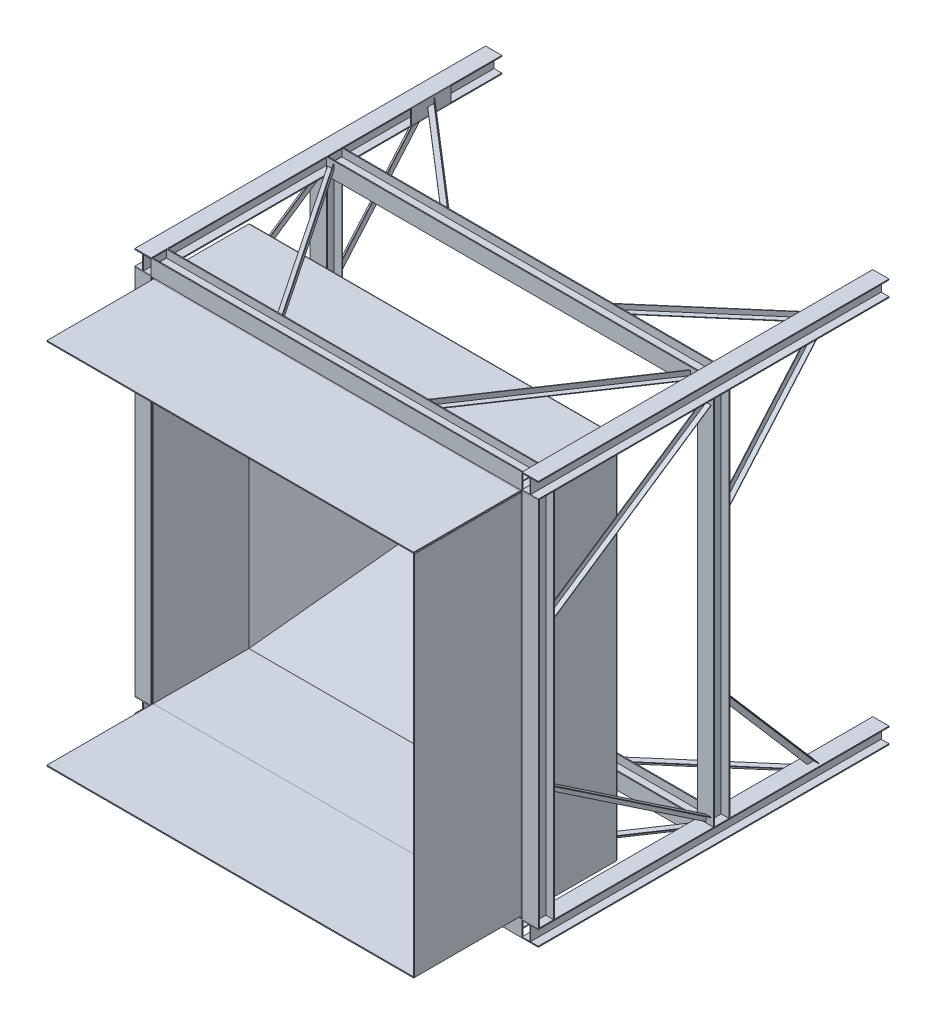
from build123d import *

# Parameters (mm, degrees)
COLUMNA_H_1_DEPTH                            = 3300
COLUMNA_H_2_DEPTH                            = 3300
COLUMNA_H_3_DEPTH                            = 3300
COLUMNA_H_4_DEPTH                            = 3300
VIGA_H_CARGA_1650_DEPTH                      = 3490
VIGA_H_CARGA_3300_DEPTH                      = 3490
CONTORNO_CIERRE_COLUMNA_CARGA_A_W            = 370
CONTORNO_CIERRE_COLUMNA_CARGA_A_H            = 135
CIERRE_COLUMNA_CARGA_A_DEPTH                 = 8
ALA_PLANA_ANGULAR_SUPERIOR_CARGA_A_DEPTH     = 5
RETORNO_ANGULAR_SUPERIOR_CARGA_A_DEPTH       = 45
ALA_PLANA_ANGULAR_INFERIOR_CARGA_A_DEPTH     = 5
RETORNO_ANGULAR_INFERIOR_CARGA_A_DEPTH       = 45
CONTORNO_CIERRE_COLUMNA_CARGA_B_W            = 370
CONTORNO_CIERRE_COLUMNA_CARGA_B_H            = 135
CIERRE_COLUMNA_CARGA_B_DEPTH                 = 8
ALA_PLANA_ANGULAR_SUPERIOR_CARGA_B_DEPTH     = 5
RETORNO_ANGULAR_SUPERIOR_CARGA_B_DEPTH       = 45
ALA_PLANA_ANGULAR_INFERIOR_CARGA_B_DEPTH     = 5
RETORNO_ANGULAR_INFERIOR_CARGA_B_DEPTH       = 45
CONTORNO_ASIENTO_SOLDADO_CARGA_W             = 2900
CONTORNO_ASIENTO_SOLDADO_CARGA_H             = 83.725
ASIENTO_SOLDADO_CARGA_DEPTH                  = 9.525
VIGA_H_FONDO_1650_DEPTH                      = 3490
VIGA_H_FONDO_3300_DEPTH                      = 3490
CONTORNO_CIERRE_COLUMNA_FONDO_A_W            = 370
CONTORNO_CIERRE_COLUMNA_FONDO_A_H            = 135
CIERRE_COLUMNA_FONDO_A_DEPTH                 = 8
ALA_PLANA_ANGULAR_SUPERIOR_FONDO_A_DEPTH     = 5
RETORNO_ANGULAR_SUPERIOR_FONDO_A_DEPTH       = 45
ALA_PLANA_ANGULAR_INFERIOR_FONDO_A_DEPTH     = 5
RETORNO_ANGULAR_INFERIOR_FONDO_A_DEPTH       = 45
CONTORNO_CIERRE_COLUMNA_FONDO_B_W            = 370
CONTORNO_CIERRE_COLUMNA_FONDO_B_H            = 135
CIERRE_COLUMNA_FONDO_B_DEPTH                 = 8
ALA_PLANA_ANGULAR_SUPERIOR_FONDO_B_DEPTH     = 5
RETORNO_ANGULAR_SUPERIOR_FONDO_B_DEPTH       = 45
ALA_PLANA_ANGULAR_INFERIOR_FONDO_B_DEPTH     = 5
RETORNO_ANGULAR_INFERIOR_FONDO_B_DEPTH       = 45
CONTORNO_ASIENTO_SOLDADO_FONDO_W             = 2900
CONTORNO_ASIENTO_SOLDADO_FONDO_H             = 83.725
ASIENTO_SOLDADO_FONDO_DEPTH                  = 9.525
VIGA_H_IZQUIERDA_1650_DEPTH                  = 3490
VIGA_H_IZQUIERDA_3300_DEPTH                  = 3490
ALA_PLANA_ANGULAR_SUPERIOR_IZQUIERDA_A_DEPTH = 5
RETORNO_ANGULAR_SUPERIOR_IZQUIERDA_A_DEPTH   = 45
ALA_PLANA_ANGULAR_INFERIOR_IZQUIERDA_A_DEPTH = 5
RETORNO_ANGULAR_INFERIOR_IZQUIERDA_A_DEPTH   = 45
ALA_PLANA_ANGULAR_SUPERIOR_IZQUIERDA_B_DEPTH = 5
RETORNO_ANGULAR_SUPERIOR_IZQUIERDA_B_DEPTH   = 45
ALA_PLANA_ANGULAR_INFERIOR_IZQUIERDA_B_DEPTH = 5
RETORNO_ANGULAR_INFERIOR_IZQUIERDA_B_DEPTH   = 45
CONTORNO_ASIENTO_SOLDADO_IZQUIERDA_W         = 83.725
CONTORNO_ASIENTO_SOLDADO_IZQUIERDA_H         = 2900
ASIENTO_SOLDADO_IZQUIERDA_DEPTH              = 9.525
VIGA_H_DERECHA_1650_DEPTH                    = 3490
VIGA_H_DERECHA_3300_DEPTH                    = 3490
ALA_PLANA_ANGULAR_SUPERIOR_DERECHA_A_DEPTH   = 5
RETORNO_ANGULAR_SUPERIOR_DERECHA_A_DEPTH     = 45
ALA_PLANA_ANGULAR_INFERIOR_DERECHA_A_DEPTH   = 5
RETORNO_ANGULAR_INFERIOR_DERECHA_A_DEPTH     = 45
ALA_PLANA_ANGULAR_SUPERIOR_DERECHA_B_DEPTH   = 5
RETORNO_ANGULAR_SUPERIOR_DERECHA_B_DEPTH     = 45
ALA_PLANA_ANGULAR_INFERIOR_DERECHA_B_DEPTH   = 5
RETORNO_ANGULAR_INFERIOR_DERECHA_B_DEPTH     = 45
CONTORNO_ASIENTO_SOLDADO_DERECHA_W           = 83.725
CONTORNO_ASIENTO_SOLDADO_DERECHA_H           = 2900
ASIENTO_SOLDADO_DERECHA_DEPTH                = 9.525
CONTORNO_COLLAR_LATERAL_Y_NEGATIVO_W         = 3450
CONTORNO_COLLAR_LATERAL_Y_NEGATIVO_H         = 900
COLLAR_LATERAL_Y_NEGATIVO_DEPTH              = 9.525
CONTORNO_ALER_N_LATERAL_Y_NEGATIVO_W         = 3450
CONTORNO_ALER_N_LATERAL_Y_NEGATIVO_H         = 1000
ALER_N_LATERAL_Y_NEGATIVO_DEPTH              = 9.525
EMBUDO_LATERAL_Y_NEGATIVO_DEPTH              = 9.525
CONTORNO_COLLAR_DERECHA_W                    = 900
CONTORNO_COLLAR_DERECHA_H                    = 3450
COLLAR_DERECHA_DEPTH                         = 9.525
CONTORNO_ALER_N_DERECHA_W                    = 1000
CONTORNO_ALER_N_DERECHA_H                    = 3450
ALER_N_DERECHA_DEPTH                         = 9.525
EMBUDO_DERECHA_DEPTH                         = 9.525
CONTORNO_COLLAR_LATERAL_Y_POSITIVO_W         = 3450
CONTORNO_COLLAR_LATERAL_Y_POSITIVO_H         = 900
COLLAR_LATERAL_Y_POSITIVO_DEPTH              = 9.525
CONTORNO_ALER_N_LATERAL_Y_POSITIVO_W         = 3450
CONTORNO_ALER_N_LATERAL_Y_POSITIVO_H         = 1000
ALER_N_LATERAL_Y_POSITIVO_DEPTH              = 9.525
EMBUDO_LATERAL_Y_POSITIVO_DEPTH              = 9.525
CONTORNO_COLLAR_CARGA_W                      = 900
CONTORNO_COLLAR_CARGA_H                      = 3450
COLLAR_CARGA_DEPTH                           = 9.525
EMBUDO_CARGA_DEPTH                           = 9.525


with BuildPart() as part:
    # Contorno Columna H 1 → Columna H 1 (new body)
    with BuildSketch(Plane.XY):
        Polygon((-1898, -1898), (-1745, -1898), (-1745, -1889), (-1818.25, -1889), (-1818.25, -1754), (-1745, -1754), (-1745, -1745), (-1898, -1745), (-1898, -1754), (-1824.75, -1754), (-1824.75, -1889), (-1898, -1889), align=None)
    extrude(amount=COLUMNA_H_1_DEPTH)


with BuildPart() as body_2:
    # Contorno Columna H 2 → Columna H 2 (new body)
    with BuildSketch(Plane.XY):
        Polygon((-1898, 1745), (-1745, 1745), (-1745, 1754), (-1818.25, 1754), (-1818.25, 1889), (-1745, 1889), (-1745, 1898), (-1898, 1898), (-1898, 1889), (-1824.75, 1889), (-1824.75, 1754), (-1898, 1754), align=None)
    extrude(amount=COLUMNA_H_2_DEPTH)


with BuildPart() as body_3:
    # Contorno Columna H 3 → Columna H 3 (new body)
    with BuildSketch(Plane.XY):
        Polygon((1745, -1898), (1898, -1898), (1898, -1889), (1824.75, -1889), (1824.75, -1754), (1898, -1754), (1898, -1745), (1745, -1745), (1745, -1754), (1818.25, -1754), (1818.25, -1889), (1745, -1889), align=None)
    extrude(amount=COLUMNA_H_3_DEPTH)


with BuildPart() as body_4:
    # Contorno Columna H 4 → Columna H 4 (new body)
    with BuildSketch(Plane.XY):
        Polygon((1745, 1745), (1898, 1745), (1898, 1754), (1824.75, 1754), (1824.75, 1889), (1898, 1889), (1898, 1898), (1745, 1898), (1745, 1889), (1818.25, 1889), (1818.25, 1754), (1745, 1754), align=None)
    extrude(amount=COLUMNA_H_4_DEPTH)


with BuildPart() as body_5:
    # Contorno Viga H carga 1650 → Viga H carga 1650 (new body)
    with BuildSketch(Plane(origin=(-1745, 0, 0), x_dir=(0, 0, -1), z_dir=(1, 0, 0))):
        Polygon((-1497, -1745), (-1497, -1898), (-1506, -1898), (-1506, -1824.75), (-1641, -1824.75), (-1641, -1898), (-1650, -1898), (-1650, -1745), (-1641, -1745), (-1641, -1818.25), (-1506, -1818.25), (-1506, -1745), align=None)
    extrude(amount=VIGA_H_CARGA_1650_DEPTH)


with BuildPart() as body_6:
    # Contorno Viga H carga 3300 → Viga H carga 3300 (new body)
    with BuildSketch(Plane(origin=(-1745, 0, 0), x_dir=(0, 0, -1), z_dir=(1, 0, 0))):
        Polygon((-3147, -1745), (-3147, -1898), (-3156, -1898), (-3156, -1824.75), (-3291, -1824.75), (-3291, -1898), (-3300, -1898), (-3300, -1745), (-3291, -1745), (-3291, -1818.25), (-3156, -1818.25), (-3156, -1745), align=None)
    extrude(amount=VIGA_H_CARGA_3300_DEPTH)


with BuildPart() as body_7:
    # Contorno Cierre columna carga A → Cierre columna carga A (new body)
    with BuildSketch(Plane(origin=(-1745, 0, 0), x_dir=(0, 0, -1), z_dir=(1, 0, 0))):
        with Locations((-665, -1821.5)):
            Rectangle(CONTORNO_CIERRE_COLUMNA_CARGA_A_W, CONTORNO_CIERRE_COLUMNA_CARGA_A_H)
    extrude(amount=-CIERRE_COLUMNA_CARGA_A_DEPTH)


with BuildPart() as body_8:
    # Contorno Ala plana Angular superior carg → Ala plana Angular superior carga A (new body)
    with BuildSketch(Plane(origin=(0, -1821.5, 0), x_dir=(1, 0, 0), z_dir=(0, 1, 0))):
        Polygon((-1674.870108064, -1650), (-1735.129891936, -1650), (-728.129891936, -3147), (-667.870108064, -3147), align=None)
    extrude(amount=-ALA_PLANA_ANGULAR_SUPERIOR_CARGA_A_DEPTH)


with BuildPart() as body_9:
    # Contorno Retorno Angular superior carga → Retorno Angular superior carga A (new body)
    with BuildSketch(Plane(origin=(0, -1826.5, 0), x_dir=(1, 0, 0), z_dir=(0, 1, 0))):
        Polygon((-1674.870108064, -1650), (-1680.896086451, -1650), (-673.896086451, -3147), (-667.870108064, -3147), align=None)
    extrude(amount=-RETORNO_ANGULAR_SUPERIOR_CARGA_A_DEPTH)


with BuildPart() as body_8_1:
    add(body_8.part)

    # Angular superior carga A: union body 9
    add(body_9.part)


with BuildPart() as body_9_2:
    # Contorno Ala plana Angular inferior carg → Ala plana Angular inferior carga A (new body)
    with BuildSketch(Plane(origin=(0, -1821.5, 0), x_dir=(1, 0, 0), z_dir=(0, 1, 0))):
        Polygon((-1745, -631.991026401), (-1745, -698.008973599), (-818.285648465, -1497), (-741.714351535, -1497), align=None)
    extrude(amount=-ALA_PLANA_ANGULAR_INFERIOR_CARGA_A_DEPTH)


with BuildPart() as body_10:
    # Contorno Retorno Angular inferior carga → Retorno Angular inferior carga A (new body)
    with BuildSketch(Plane(origin=(0, -1826.5, 0), x_dir=(1, 0, 0), z_dir=(0, 1, 0))):
        Polygon((-1745, -631.991026401), (-1745, -638.592821121), (-749.371481228, -1497), (-741.714351535, -1497), align=None)
    extrude(amount=-RETORNO_ANGULAR_INFERIOR_CARGA_A_DEPTH)


with BuildPart() as body_9_2_1:
    add(body_9_2.part)

    # Angular inferior carga A: union body 10
    add(body_10.part)


with BuildPart() as body_10_2:
    # Contorno Cierre columna carga B → Cierre columna carga B (new body)
    with BuildSketch(Plane(origin=(1745, 0, 0), x_dir=(0, 0, -1), z_dir=(1, 0, 0))):
        with Locations((-665, -1821.5)):
            Rectangle(CONTORNO_CIERRE_COLUMNA_CARGA_B_W, CONTORNO_CIERRE_COLUMNA_CARGA_B_H)
    extrude(amount=CIERRE_COLUMNA_CARGA_B_DEPTH)


with BuildPart() as body_11:
    # Contorno Ala plana Angular superior  2 → Ala plana Angular superior carga B (new body)
    with BuildSketch(Plane(origin=(0, -1821.5, 0), x_dir=(1, 0, 0), z_dir=(0, 1, 0))):
        Polygon((1674.870108064, -1650), (1735.129891936, -1650), (728.129891936, -3147), (667.870108064, -3147), align=None)
    extrude(amount=-ALA_PLANA_ANGULAR_SUPERIOR_CARGA_B_DEPTH)


with BuildPart() as body_12:
    # Contorno Retorno Angular superior ca 2 → Retorno Angular superior carga B (new body)
    with BuildSketch(Plane(origin=(0, -1826.5, 0), x_dir=(1, 0, 0), z_dir=(0, 1, 0))):
        Polygon((1674.870108064, -1650), (1680.896086451, -1650), (673.896086451, -3147), (667.870108064, -3147), align=None)
    extrude(amount=-RETORNO_ANGULAR_SUPERIOR_CARGA_B_DEPTH)


with BuildPart() as body_11_1:
    add(body_11.part)

    # Angular superior carga B: union body 12
    add(body_12.part)


with BuildPart() as body_12_2:
    # Contorno Ala plana Angular inferior  2 → Ala plana Angular inferior carga B (new body)
    with BuildSketch(Plane(origin=(0, -1821.5, 0), x_dir=(1, 0, 0), z_dir=(0, 1, 0))):
        Polygon((1745, -631.991026401), (1745, -698.008973599), (818.285648465, -1497), (741.714351535, -1497), align=None)
    extrude(amount=-ALA_PLANA_ANGULAR_INFERIOR_CARGA_B_DEPTH)


with BuildPart() as body_13:
    # Contorno Retorno Angular inferior ca 2 → Retorno Angular inferior carga B (new body)
    with BuildSketch(Plane(origin=(0, -1826.5, 0), x_dir=(1, 0, 0), z_dir=(0, 1, 0))):
        Polygon((1745, -631.991026401), (1745, -638.592821121), (749.371481228, -1497), (741.714351535, -1497), align=None)
    extrude(amount=-RETORNO_ANGULAR_INFERIOR_CARGA_B_DEPTH)


with BuildPart() as body_12_2_1:
    add(body_12_2.part)

    # Angular inferior carga B: union body 13
    add(body_13.part)


with BuildPart() as body_13_2:
    # Contorno Asiento soldado carga → Asiento soldado carga (new body)
    with BuildSketch(Plane.XY.offset(3281.475)):
        with Locations((0, -1776.3875)):
            Rectangle(CONTORNO_ASIENTO_SOLDADO_CARGA_W, CONTORNO_ASIENTO_SOLDADO_CARGA_H)
    extrude(amount=ASIENTO_SOLDADO_CARGA_DEPTH)


with BuildPart() as body_14:
    # Contorno Viga H fondo 1650 → Viga H fondo 1650 (new body)
    with BuildSketch(Plane(origin=(-1745, 0, 0), x_dir=(0, 0, -1), z_dir=(1, 0, 0))):
        Polygon((-1497, 1745), (-1497, 1898), (-1506, 1898), (-1506, 1824.75), (-1641, 1824.75), (-1641, 1898), (-1650, 1898), (-1650, 1745), (-1641, 1745), (-1641, 1818.25), (-1506, 1818.25), (-1506, 1745), align=None)
    extrude(amount=VIGA_H_FONDO_1650_DEPTH)


with BuildPart() as body_15:
    # Contorno Viga H fondo 3300 → Viga H fondo 3300 (new body)
    with BuildSketch(Plane(origin=(-1745, 0, 0), x_dir=(0, 0, -1), z_dir=(1, 0, 0))):
        Polygon((-3147, 1745), (-3147, 1898), (-3156, 1898), (-3156, 1824.75), (-3291, 1824.75), (-3291, 1898), (-3300, 1898), (-3300, 1745), (-3291, 1745), (-3291, 1818.25), (-3156, 1818.25), (-3156, 1745), align=None)
    extrude(amount=VIGA_H_FONDO_3300_DEPTH)


with BuildPart() as body_16:
    # Contorno Cierre columna fondo A → Cierre columna fondo A (new body)
    with BuildSketch(Plane(origin=(-1745, 0, 0), x_dir=(0, 0, -1), z_dir=(1, 0, 0))):
        with Locations((-665, 1821.5)):
            Rectangle(CONTORNO_CIERRE_COLUMNA_FONDO_A_W, CONTORNO_CIERRE_COLUMNA_FONDO_A_H)
    extrude(amount=-CIERRE_COLUMNA_FONDO_A_DEPTH)


with BuildPart() as body_17:
    # Contorno Ala plana Angular superior fond → Ala plana Angular superior fondo A (new body)
    with BuildSketch(Plane(origin=(0, 1821.5, 0), x_dir=(1, 0, 0), z_dir=(0, 1, 0))):
        Polygon((-1674.870108064, -1650), (-1735.129891936, -1650), (-728.129891936, -3147), (-667.870108064, -3147), align=None)
    extrude(amount=ALA_PLANA_ANGULAR_SUPERIOR_FONDO_A_DEPTH)


with BuildPart() as body_18:
    # Contorno Retorno Angular superior fondo → Retorno Angular superior fondo A (new body)
    with BuildSketch(Plane(origin=(0, 1826.5, 0), x_dir=(1, 0, 0), z_dir=(0, 1, 0))):
        Polygon((-1674.870108064, -1650), (-1680.896086451, -1650), (-673.896086451, -3147), (-667.870108064, -3147), align=None)
    extrude(amount=RETORNO_ANGULAR_SUPERIOR_FONDO_A_DEPTH)


with BuildPart() as body_17_1:
    add(body_17.part)

    # Angular superior fondo A: union body 18
    add(body_18.part)


with BuildPart() as body_18_2:
    # Contorno Ala plana Angular inferior fond → Ala plana Angular inferior fondo A (new body)
    with BuildSketch(Plane(origin=(0, 1821.5, 0), x_dir=(1, 0, 0), z_dir=(0, 1, 0))):
        Polygon((-1745, -631.991026401), (-1745, -698.008973599), (-818.285648465, -1497), (-741.714351535, -1497), align=None)
    extrude(amount=ALA_PLANA_ANGULAR_INFERIOR_FONDO_A_DEPTH)


with BuildPart() as body_19:
    # Contorno Retorno Angular inferior fondo → Retorno Angular inferior fondo A (new body)
    with BuildSketch(Plane(origin=(0, 1826.5, 0), x_dir=(1, 0, 0), z_dir=(0, 1, 0))):
        Polygon((-1745, -631.991026401), (-1745, -638.592821121), (-749.371481228, -1497), (-741.714351535, -1497), align=None)
    extrude(amount=RETORNO_ANGULAR_INFERIOR_FONDO_A_DEPTH)


with BuildPart() as body_18_2_1:
    add(body_18_2.part)

    # Angular inferior fondo A: union body 19
    add(body_19.part)


with BuildPart() as body_19_2:
    # Contorno Cierre columna fondo B → Cierre columna fondo B (new body)
    with BuildSketch(Plane(origin=(1745, 0, 0), x_dir=(0, 0, -1), z_dir=(1, 0, 0))):
        with Locations((-665, 1821.5)):
            Rectangle(CONTORNO_CIERRE_COLUMNA_FONDO_B_W, CONTORNO_CIERRE_COLUMNA_FONDO_B_H)
    extrude(amount=CIERRE_COLUMNA_FONDO_B_DEPTH)


with BuildPart() as body_20:
    # Contorno Ala plana Angular superior  3 → Ala plana Angular superior fondo B (new body)
    with BuildSketch(Plane(origin=(0, 1821.5, 0), x_dir=(1, 0, 0), z_dir=(0, 1, 0))):
        Polygon((1674.870108064, -1650), (1735.129891936, -1650), (728.129891936, -3147), (667.870108064, -3147), align=None)
    extrude(amount=ALA_PLANA_ANGULAR_SUPERIOR_FONDO_B_DEPTH)


with BuildPart() as body_21:
    # Contorno Retorno Angular superior fo 2 → Retorno Angular superior fondo B (new body)
    with BuildSketch(Plane(origin=(0, 1826.5, 0), x_dir=(1, 0, 0), z_dir=(0, 1, 0))):
        Polygon((1674.870108064, -1650), (1680.896086451, -1650), (673.896086451, -3147), (667.870108064, -3147), align=None)
    extrude(amount=RETORNO_ANGULAR_SUPERIOR_FONDO_B_DEPTH)


with BuildPart() as body_20_1:
    add(body_20.part)

    # Angular superior fondo B: union body 21
    add(body_21.part)


with BuildPart() as body_21_2:
    # Contorno Ala plana Angular inferior  3 → Ala plana Angular inferior fondo B (new body)
    with BuildSketch(Plane(origin=(0, 1821.5, 0), x_dir=(1, 0, 0), z_dir=(0, 1, 0))):
        Polygon((1745, -631.991026401), (1745, -698.008973599), (818.285648465, -1497), (741.714351535, -1497), align=None)
    extrude(amount=ALA_PLANA_ANGULAR_INFERIOR_FONDO_B_DEPTH)


with BuildPart() as body_22:
    # Contorno Retorno Angular inferior fo 2 → Retorno Angular inferior fondo B (new body)
    with BuildSketch(Plane(origin=(0, 1826.5, 0), x_dir=(1, 0, 0), z_dir=(0, 1, 0))):
        Polygon((1745, -631.991026401), (1745, -638.592821121), (749.371481228, -1497), (741.714351535, -1497), align=None)
    extrude(amount=RETORNO_ANGULAR_INFERIOR_FONDO_B_DEPTH)


with BuildPart() as body_21_2_1:
    add(body_21_2.part)

    # Angular inferior fondo B: union body 22
    add(body_22.part)


with BuildPart() as body_22_2:
    # Contorno Asiento soldado fondo → Asiento soldado fondo (new body)
    with BuildSketch(Plane.XY.offset(3281.475)):
        with Locations((0, 1776.3875)):
            Rectangle(CONTORNO_ASIENTO_SOLDADO_FONDO_W, CONTORNO_ASIENTO_SOLDADO_FONDO_H)
    extrude(amount=ASIENTO_SOLDADO_FONDO_DEPTH)


with BuildPart() as body_23:
    # Contorno Viga H izquierda 1650 → Viga H izquierda 1650 (new body)
    with BuildSketch(Plane(origin=(0, -1745, 0), x_dir=(1, 0, 0), z_dir=(0, 1, 0))):
        Polygon((-1745, -1497), (-1898, -1497), (-1898, -1506), (-1824.75, -1506), (-1824.75, -1641), (-1898, -1641), (-1898, -1650), (-1745, -1650), (-1745, -1641), (-1818.25, -1641), (-1818.25, -1506), (-1745, -1506), align=None)
    extrude(amount=VIGA_H_IZQUIERDA_1650_DEPTH)


with BuildPart() as body_24:
    # Contorno Viga H izquierda 3300 → Viga H izquierda 3300 (new body)
    with BuildSketch(Plane(origin=(0, -1745, 0), x_dir=(1, 0, 0), z_dir=(0, 1, 0))):
        Polygon((-1745, -3147), (-1898, -3147), (-1898, -3156), (-1824.75, -3156), (-1824.75, -3291), (-1898, -3291), (-1898, -3300), (-1745, -3300), (-1745, -3291), (-1818.25, -3291), (-1818.25, -3156), (-1745, -3156), align=None)
    extrude(amount=VIGA_H_IZQUIERDA_3300_DEPTH)


with BuildPart() as body_25:
    # Contorno Ala plana Angular superior izqu → Ala plana Angular superior izquierda A (new body)
    with BuildSketch(Plane(origin=(-1821.5, 0, 0), x_dir=(0, 0, -1), z_dir=(1, 0, 0))):
        Polygon((-1650, -1674.870108064), (-1650, -1735.129891936), (-3147, -728.129891936), (-3147, -667.870108064), align=None)
    extrude(amount=-ALA_PLANA_ANGULAR_SUPERIOR_IZQUIERDA_A_DEPTH)


with BuildPart() as body_26:
    # Contorno Retorno Angular superior izquie → Retorno Angular superior izquierda A (new body)
    with BuildSketch(Plane(origin=(-1826.5, 0, 0), x_dir=(0, 0, -1), z_dir=(1, 0, 0))):
        Polygon((-1650, -1674.870108064), (-1650, -1680.896086451), (-3147, -673.896086451), (-3147, -667.870108064), align=None)
    extrude(amount=-RETORNO_ANGULAR_SUPERIOR_IZQUIERDA_A_DEPTH)


with BuildPart() as body_25_1:
    add(body_25.part)

    # Angular superior izquierda A: union body 26
    add(body_26.part)


with BuildPart() as body_26_2:
    # Contorno Ala plana Angular inferior izqu → Ala plana Angular inferior izquierda A (new body)
    with BuildSketch(Plane(origin=(-1821.5, 0, 0), x_dir=(0, 0, -1), z_dir=(1, 0, 0))):
        Polygon((-631.991026401, -1745), (-698.008973599, -1745), (-1497, -818.285648465), (-1497, -741.714351535), align=None)
    extrude(amount=-ALA_PLANA_ANGULAR_INFERIOR_IZQUIERDA_A_DEPTH)


with BuildPart() as body_27:
    # Contorno Retorno Angular inferior izquie → Retorno Angular inferior izquierda A (new body)
    with BuildSketch(Plane(origin=(-1826.5, 0, 0), x_dir=(0, 0, -1), z_dir=(1, 0, 0))):
        Polygon((-631.991026401, -1745), (-638.592821121, -1745), (-1497, -749.371481228), (-1497, -741.714351535), align=None)
    extrude(amount=-RETORNO_ANGULAR_INFERIOR_IZQUIERDA_A_DEPTH)


with BuildPart() as body_26_2_1:
    add(body_26_2.part)

    # Angular inferior izquierda A: union body 27
    add(body_27.part)


with BuildPart() as body_27_2:
    # Contorno Ala plana Angular superior  4 → Ala plana Angular superior izquierda B (new body)
    with BuildSketch(Plane(origin=(-1821.5, 0, 0), x_dir=(0, 0, -1), z_dir=(1, 0, 0))):
        Polygon((-1650, 1674.870108064), (-1650, 1735.129891936), (-3147, 728.129891936), (-3147, 667.870108064), align=None)
    extrude(amount=-ALA_PLANA_ANGULAR_SUPERIOR_IZQUIERDA_B_DEPTH)


with BuildPart() as body_28:
    # Contorno Retorno Angular superior iz 2 → Retorno Angular superior izquierda B (new body)
    with BuildSketch(Plane(origin=(-1826.5, 0, 0), x_dir=(0, 0, -1), z_dir=(1, 0, 0))):
        Polygon((-1650, 1674.870108064), (-1650, 1680.896086451), (-3147, 673.896086451), (-3147, 667.870108064), align=None)
    extrude(amount=-RETORNO_ANGULAR_SUPERIOR_IZQUIERDA_B_DEPTH)


with BuildPart() as body_27_2_1:
    add(body_27_2.part)

    # Angular superior izquierda B: union body 28
    add(body_28.part)


with BuildPart() as body_28_2:
    # Contorno Ala plana Angular inferior  4 → Ala plana Angular inferior izquierda B (new body)
    with BuildSketch(Plane(origin=(-1821.5, 0, 0), x_dir=(0, 0, -1), z_dir=(1, 0, 0))):
        Polygon((-631.991026401, 1745), (-698.008973599, 1745), (-1497, 818.285648465), (-1497, 741.714351535), align=None)
    extrude(amount=-ALA_PLANA_ANGULAR_INFERIOR_IZQUIERDA_B_DEPTH)


with BuildPart() as body_29:
    # Contorno Retorno Angular inferior iz 2 → Retorno Angular inferior izquierda B (new body)
    with BuildSketch(Plane(origin=(-1826.5, 0, 0), x_dir=(0, 0, -1), z_dir=(1, 0, 0))):
        Polygon((-631.991026401, 1745), (-638.592821121, 1745), (-1497, 749.371481228), (-1497, 741.714351535), align=None)
    extrude(amount=-RETORNO_ANGULAR_INFERIOR_IZQUIERDA_B_DEPTH)


with BuildPart() as body_28_2_1:
    add(body_28_2.part)

    # Angular inferior izquierda B: union body 29
    add(body_29.part)


with BuildPart() as body_29_2:
    # Contorno Asiento soldado izquierda → Asiento soldado izquierda (new body)
    with BuildSketch(Plane.XY.offset(3281.475)):
        with Locations((-1776.3875, 0)):
            Rectangle(CONTORNO_ASIENTO_SOLDADO_IZQUIERDA_W, CONTORNO_ASIENTO_SOLDADO_IZQUIERDA_H)
    extrude(amount=ASIENTO_SOLDADO_IZQUIERDA_DEPTH)


with BuildPart() as body_30:
    # Contorno Viga H derecha 1650 → Viga H derecha 1650 (new body)
    with BuildSketch(Plane(origin=(0, -1745, 0), x_dir=(1, 0, 0), z_dir=(0, 1, 0))):
        Polygon((1745, -1497), (1898, -1497), (1898, -1506), (1824.75, -1506), (1824.75, -1641), (1898, -1641), (1898, -1650), (1745, -1650), (1745, -1641), (1818.25, -1641), (1818.25, -1506), (1745, -1506), align=None)
    extrude(amount=VIGA_H_DERECHA_1650_DEPTH)


with BuildPart() as body_31:
    # Contorno Viga H derecha 3300 → Viga H derecha 3300 (new body)
    with BuildSketch(Plane(origin=(0, -1745, 0), x_dir=(1, 0, 0), z_dir=(0, 1, 0))):
        Polygon((1745, -3147), (1898, -3147), (1898, -3156), (1824.75, -3156), (1824.75, -3291), (1898, -3291), (1898, -3300), (1745, -3300), (1745, -3291), (1818.25, -3291), (1818.25, -3156), (1745, -3156), align=None)
    extrude(amount=VIGA_H_DERECHA_3300_DEPTH)


with BuildPart() as body_32:
    # Contorno Ala plana Angular superior dere → Ala plana Angular superior derecha A (new body)
    with BuildSketch(Plane(origin=(1821.5, 0, 0), x_dir=(0, 0, -1), z_dir=(1, 0, 0))):
        Polygon((-1650, -1674.870108064), (-1650, -1735.129891936), (-3147, -728.129891936), (-3147, -667.870108064), align=None)
    extrude(amount=ALA_PLANA_ANGULAR_SUPERIOR_DERECHA_A_DEPTH)


with BuildPart() as body_33:
    # Contorno Retorno Angular superior derech → Retorno Angular superior derecha A (new body)
    with BuildSketch(Plane(origin=(1826.5, 0, 0), x_dir=(0, 0, -1), z_dir=(1, 0, 0))):
        Polygon((-1650, -1674.870108064), (-1650, -1680.896086451), (-3147, -673.896086451), (-3147, -667.870108064), align=None)
    extrude(amount=RETORNO_ANGULAR_SUPERIOR_DERECHA_A_DEPTH)


with BuildPart() as body_32_1:
    add(body_32.part)

    # Angular superior derecha A: union body 33
    add(body_33.part)


with BuildPart() as body_33_2:
    # Contorno Ala plana Angular inferior dere → Ala plana Angular inferior derecha A (new body)
    with BuildSketch(Plane(origin=(1821.5, 0, 0), x_dir=(0, 0, -1), z_dir=(1, 0, 0))):
        Polygon((-631.991026401, -1745), (-698.008973599, -1745), (-1497, -818.285648465), (-1497, -741.714351535), align=None)
    extrude(amount=ALA_PLANA_ANGULAR_INFERIOR_DERECHA_A_DEPTH)


with BuildPart() as body_34:
    # Contorno Retorno Angular inferior derech → Retorno Angular inferior derecha A (new body)
    with BuildSketch(Plane(origin=(1826.5, 0, 0), x_dir=(0, 0, -1), z_dir=(1, 0, 0))):
        Polygon((-631.991026401, -1745), (-638.592821121, -1745), (-1497, -749.371481228), (-1497, -741.714351535), align=None)
    extrude(amount=RETORNO_ANGULAR_INFERIOR_DERECHA_A_DEPTH)


with BuildPart() as body_33_2_1:
    add(body_33_2.part)

    # Angular inferior derecha A: union body 34
    add(body_34.part)


with BuildPart() as body_34_2:
    # Contorno Ala plana Angular superior  5 → Ala plana Angular superior derecha B (new body)
    with BuildSketch(Plane(origin=(1821.5, 0, 0), x_dir=(0, 0, -1), z_dir=(1, 0, 0))):
        Polygon((-1650, 1674.870108064), (-1650, 1735.129891936), (-3147, 728.129891936), (-3147, 667.870108064), align=None)
    extrude(amount=ALA_PLANA_ANGULAR_SUPERIOR_DERECHA_B_DEPTH)


with BuildPart() as body_35:
    # Contorno Retorno Angular superior de 2 → Retorno Angular superior derecha B (new body)
    with BuildSketch(Plane(origin=(1826.5, 0, 0), x_dir=(0, 0, -1), z_dir=(1, 0, 0))):
        Polygon((-1650, 1674.870108064), (-1650, 1680.896086451), (-3147, 673.896086451), (-3147, 667.870108064), align=None)
    extrude(amount=RETORNO_ANGULAR_SUPERIOR_DERECHA_B_DEPTH)


with BuildPart() as body_34_2_1:
    add(body_34_2.part)

    # Angular superior derecha B: union body 35
    add(body_35.part)


with BuildPart() as body_35_2:
    # Contorno Ala plana Angular inferior  5 → Ala plana Angular inferior derecha B (new body)
    with BuildSketch(Plane(origin=(1821.5, 0, 0), x_dir=(0, 0, -1), z_dir=(1, 0, 0))):
        Polygon((-631.991026401, 1745), (-698.008973599, 1745), (-1497, 818.285648465), (-1497, 741.714351535), align=None)
    extrude(amount=ALA_PLANA_ANGULAR_INFERIOR_DERECHA_B_DEPTH)


with BuildPart() as body_36:
    # Contorno Retorno Angular inferior de 2 → Retorno Angular inferior derecha B (new body)
    with BuildSketch(Plane(origin=(1826.5, 0, 0), x_dir=(0, 0, -1), z_dir=(1, 0, 0))):
        Polygon((-631.991026401, 1745), (-638.592821121, 1745), (-1497, 749.371481228), (-1497, 741.714351535), align=None)
    extrude(amount=RETORNO_ANGULAR_INFERIOR_DERECHA_B_DEPTH)


with BuildPart() as body_35_2_1:
    add(body_35_2.part)

    # Angular inferior derecha B: union body 36
    add(body_36.part)


with BuildPart() as body_36_2:
    # Contorno Asiento soldado derecha → Asiento soldado derecha (new body)
    with BuildSketch(Plane.XY.offset(3281.475)):
        with Locations((1776.3875, 0)):
            Rectangle(CONTORNO_ASIENTO_SOLDADO_DERECHA_W, CONTORNO_ASIENTO_SOLDADO_DERECHA_H)
    extrude(amount=ASIENTO_SOLDADO_DERECHA_DEPTH)


with BuildPart() as body_37:
    # Contorno Collar lateral Y negativo → Collar lateral Y negativo (new body)
    with BuildSketch(Plane(origin=(0, -1725, 0), x_dir=(1, 0, 0), z_dir=(0, 1, 0))):
        with Locations((0, -2850)):
            Rectangle(CONTORNO_COLLAR_LATERAL_Y_NEGATIVO_W, CONTORNO_COLLAR_LATERAL_Y_NEGATIVO_H)
    extrude(amount=-COLLAR_LATERAL_Y_NEGATIVO_DEPTH)


with BuildPart() as body_38:
    # Contorno Alerón lateral Y negativo → Alerón lateral Y negativo (new body)
    with BuildSketch(Plane(origin=(0, -1725, 0), x_dir=(1, 0, 0), z_dir=(0, 1, 0))):
        with Locations((0, -3800)):
            Rectangle(CONTORNO_ALER_N_LATERAL_Y_NEGATIVO_W, CONTORNO_ALER_N_LATERAL_Y_NEGATIVO_H)
    extrude(amount=-ALER_N_LATERAL_Y_NEGATIVO_DEPTH)


with BuildPart() as body_39:
    # Contorno Embudo lateral Y negativo → Embudo lateral Y negativo (new body)
    with BuildSketch(Plane(origin=(0, 601.095747456, 995.564831724), x_dir=(1, 0, 0), z_dir=(0, 0.5168690990339176, 0.8560644452749256))):
        Polygon((-1725, -2717.197005781), (1725, -2717.197005781), (600, -1169.416336564), (-600, -1169.416336564), align=None)
    extrude(amount=-EMBUDO_LATERAL_Y_NEGATIVO_DEPTH)


with BuildPart() as body_40:
    # Contorno Collar derecha → Collar derecha (new body)
    with BuildSketch(Plane(origin=(1725, 0, 0), x_dir=(0, 0, -1), z_dir=(1, 0, 0))):
        with Locations((-2850, 0)):
            Rectangle(CONTORNO_COLLAR_DERECHA_W, CONTORNO_COLLAR_DERECHA_H)
    extrude(amount=COLLAR_DERECHA_DEPTH)


with BuildPart() as body_41:
    # Contorno Alerón derecha → Alerón derecha (new body)
    with BuildSketch(Plane(origin=(1725, 0, 0), x_dir=(0, 0, -1), z_dir=(1, 0, 0))):
        with Locations((-3800, 0)):
            Rectangle(CONTORNO_ALER_N_DERECHA_W, CONTORNO_ALER_N_DERECHA_H)
    extrude(amount=ALER_N_DERECHA_DEPTH)


with BuildPart() as body_42:
    # Contorno Embudo derecha → Embudo derecha (new body)
    with BuildSketch(Plane(origin=(-554.148901279, 0, 779.271892424), x_dir=(-0.814955324568755, 0, -0.5795237863600037), z_dir=(0.5795237863600037, 0, -0.814955324568755))):
        Polygon((-2796.655022145, -1725), (-2796.655022145, 1725), (-1416.211252917, 400), (-1416.211252917, -400), align=None)
    extrude(amount=EMBUDO_DERECHA_DEPTH)


with BuildPart() as body_43:
    # Contorno Collar lateral Y positivo → Collar lateral Y positivo (new body)
    with BuildSketch(Plane(origin=(0, 1725, 0), x_dir=(1, 0, 0), z_dir=(0, 1, 0))):
        with Locations((0, -2850)):
            Rectangle(CONTORNO_COLLAR_LATERAL_Y_POSITIVO_W, CONTORNO_COLLAR_LATERAL_Y_POSITIVO_H)
    extrude(amount=COLLAR_LATERAL_Y_POSITIVO_DEPTH)


with BuildPart() as body_44:
    # Contorno Alerón lateral Y positivo → Alerón lateral Y positivo (new body)
    with BuildSketch(Plane(origin=(0, 1725, 0), x_dir=(1, 0, 0), z_dir=(0, 1, 0))):
        with Locations((0, -3800)):
            Rectangle(CONTORNO_ALER_N_LATERAL_Y_POSITIVO_W, CONTORNO_ALER_N_LATERAL_Y_POSITIVO_H)
    extrude(amount=ALER_N_LATERAL_Y_POSITIVO_DEPTH)


with BuildPart() as body_45:
    # Contorno Embudo lateral Y positivo → Embudo lateral Y positivo (new body)
    with BuildSketch(Plane(origin=(0, -601.095747456, 995.564831724), x_dir=(-1, 0, 0), z_dir=(0, 0.5168690990339176, -0.8560644452749256))):
        Polygon((-1725, 2717.197005781), (1725, 2717.197005781), (600, 1169.416336564), (-600, 1169.416336564), align=None)
    extrude(amount=EMBUDO_LATERAL_Y_POSITIVO_DEPTH)


with BuildPart() as body_46:
    # Contorno Collar carga → Collar carga (new body)
    with BuildSketch(Plane(origin=(-1725, 0, 0), x_dir=(0, 0, -1), z_dir=(1, 0, 0))):
        with Locations((-2850, 0)):
            Rectangle(CONTORNO_COLLAR_CARGA_W, CONTORNO_COLLAR_CARGA_H)
    extrude(amount=-COLLAR_CARGA_DEPTH)


with BuildPart() as body_47:
    # Contorno Embudo carga → Embudo carga (new body)
    with BuildSketch(Plane(origin=(554.148901279, 0, 779.271892424), x_dir=(0.8149553245687554, 0, -0.5795237863600032), z_dir=(0.5795237863600031, 0, 0.8149553245687553))):
        Polygon((-2796.655022145, 1725), (-2796.655022145, -1725), (-1416.211252917, -400), (-1416.211252917, 400), align=None)
    extrude(amount=-EMBUDO_CARGA_DEPTH)


solid = Compound([part.part, body_2.part, body_3.part, body_4.part, body_5.part, body_6.part, body_7.part, body_8_1.part, body_9_2_1.part, body_10_2.part, body_11_1.part, body_12_2_1.part, body_13_2.part, body_14.part, body_15.part, body_16.part, body_17_1.part, body_18_2_1.part, body_19_2.part, body_20_1.part, body_21_2_1.part, body_22_2.part, body_23.part, body_24.part, body_25_1.part, body_26_2_1.part, body_27_2_1.part, body_28_2_1.part, body_29_2.part, body_30.part, body_31.part, body_32_1.part, body_33_2_1.part, body_34_2_1.part, body_35_2_1.part, body_36_2.part, body_37.part, body_38.part, body_39.part, body_40.part, body_41.part, body_42.part, body_43.part, body_44.part, body_45.part, body_46.part, body_47.part])
